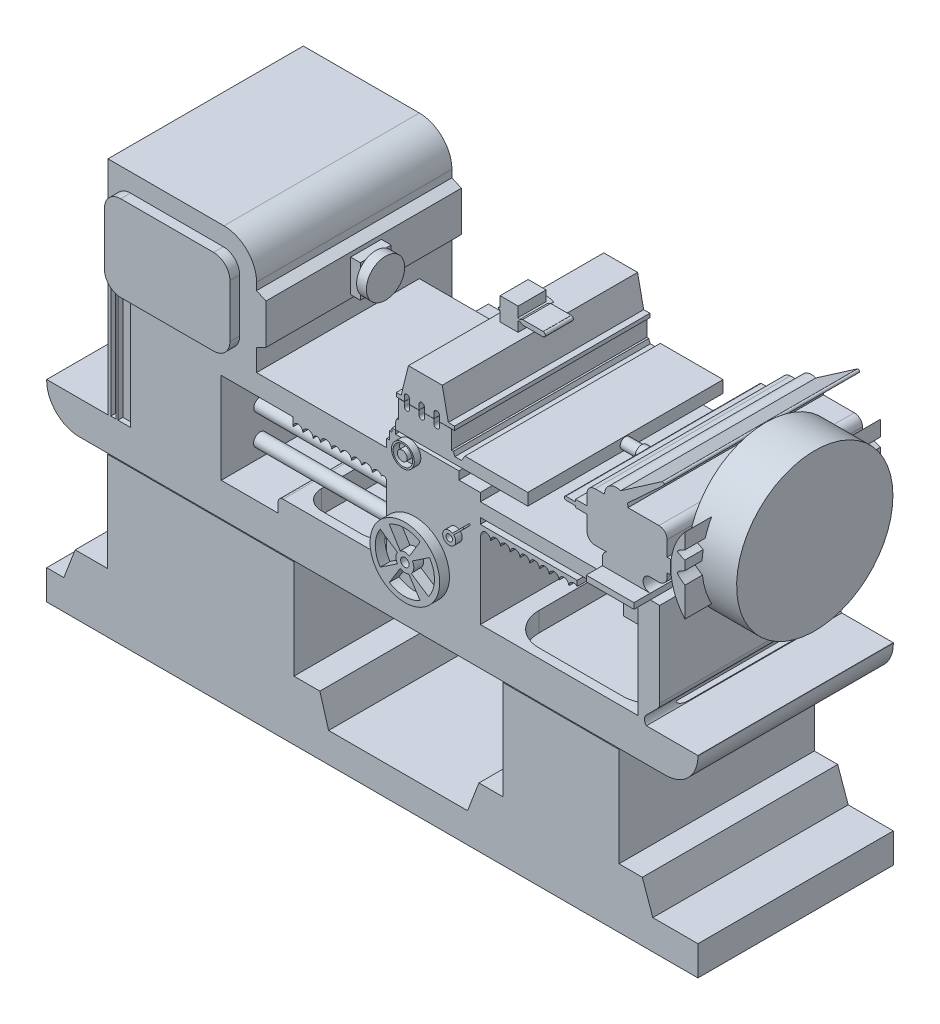
from build123d import *

# Parameters (mm, degrees)
BOSS_EXTRUDE5_DEPTH  = 60
SKETCH5_W            = 57.234946247
SKETCH5_H            = 30.414705735
SKETCH5_W_2          = 35.668154908
BOSS_EXTRUDE6_DEPTH  = 60
BOSS_EXTRUDE7_DEPTH  = 60
BOSS_EXTRUDE8_DEPTH  = 60
SKETCH8_W            = 45.623309293
SKETCH8_H            = 33.775767045
CUT_EXTRUDE2_DEPTH   = 50
SKETCH9_W            = 3.613727469
SKETCH9_H            = 33.775767045
BOSS_EXTRUDE9_DEPTH  = 50
SKETCH10_W           = 7.679170871
SKETCH10_H           = 33.775767045
BOSS_EXTRUDE10_DEPTH = 50
SKETCH11_W           = 23.489228547
SKETCH11_H           = 27.903459908
BOSS_EXTRUDE11_DEPTH = 50
SKETCH12_W           = 74.984844976
SKETCH12_H           = 6.149629091
BOSS_EXTRUDE12_DEPTH = 50
SKETCH14_W           = 4.650299087
SKETCH14_H           = 6.583511459
SKETCH14_H_2         = 6.58351146
BOSS_EXTRUDE13_DEPTH = 15
SKETCH15_R           = 1.5
CUT_EXTRUDE3_DEPTH   = 15
SKETCH16_W           = 1.513910095
SKETCH16_H           = 33.920589402
CUT_EXTRUDE5_DEPTH   = 1.5
SKETCH17_W           = 3.784775236
SKETCH17_H           = 33.726552663
CUT_EXTRUDE6_DEPTH   = 1.5
BOSS_EXTRUDE14_DEPTH = 60
SKETCH19_W           = 9.447911135
SKETCH19_H           = 9.972795087
BOSS_EXTRUDE15_DEPTH = 3
SKETCH20_R           = 5.878993698
BOSS_EXTRUDE16_DEPTH = 3
BOSS_EXTRUDE17_DEPTH = 60
BOSS_EXTRUDE18_DEPTH = 60
SKETCH24_R           = 3.5
SKETCH24_R_2         = 3
BOSS_EXTRUDE19_DEPTH = 2
SKETCH25_R           = 1.5
BOSS_EXTRUDE20_DEPTH = 2.2
SKETCH26_R           = 2
SKETCH26_R_2         = 1
BOSS_EXTRUDE21_DEPTH = 2
BOSS_EXTRUDE22_DEPTH = 2
SKETCH28_R           = 0.202033878
BOSS_EXTRUDE23_DEPTH = 2
SKETCH29_R           = 10.7
SKETCH29_R_2         = 1.3
BOSS_EXTRUDE24_DEPTH = 3
BOSS_EXTRUDE25_DEPTH = 60
SKETCH33_R           = 2
BOSS_EXTRUDE26_DEPTH = 46
BOSS_EXTRUDE27_DEPTH = 60
SKETCH35_W           = 48.387031852
SKETCH35_H           = 28.479224462
CUT_EXTRUDE7_DEPTH   = 50
SKETCH36_W           = 13.207215837
SKETCH36_H           = 23.454193641
BOSS_EXTRUDE28_DEPTH = 10
BOSS_EXTRUDE29_DEPTH = 60
SKETCH38_W           = 48.387031852
SKETCH38_H           = 28.479224462
CUT_EXTRUDE8_DEPTH   = 60
CUT_EXTRUDE9_DEPTH   = 6
SKETCH42_W           = 4.650299087
SKETCH42_H           = 6.583511459
SKETCH42_H_2         = 6.58351146
CUT_EXTRUDE10_DEPTH  = 20
SKETCH44_W           = 6.603607919
SKETCH44_H           = 7.51445039
SKETCH44_W_2         = 6.737344211
BOSS_EXTRUDE30_DEPTH = 5
SKETCH45_R           = 1.45
BOSS_EXTRUDE31_DEPTH = 120
SKETCH46_W           = 5.692765447
SKETCH46_H           = 7.059029154
BOSS_EXTRUDE32_DEPTH = 5
SKETCH48_W           = 10
SKETCH48_H           = 23.454193641
BOSS_EXTRUDE33_DEPTH = 7
CUT_EXTRUDE12_DEPTH  = 7
BOSS_EXTRUDE34_DEPTH = 3
BOSS_EXTRUDE35_DEPTH = 60
SKETCH60_W           = 21.322350294
SKETCH60_H           = 2.452770553
BOSS_EXTRUDE44_DEPTH = 60
BOSS_EXTRUDE48_DEPTH = 60
SKETCH65_W           = 0.979032425
SKETCH65_H           = 1.196132254
BOSS_EXTRUDE49_DEPTH = 60
BOSS_EXTRUDE51_DEPTH = 60
SKETCH67_W           = 16.18883209
SKETCH67_H           = 5.64438207
BOSS_EXTRUDE52_DEPTH = 60
SKETCH68_W           = 17.863538858
SKETCH68_H           = 1.178497355
BOSS_EXTRUDE53_DEPTH = 60
BOSS_EXTRUDE54_DEPTH = 60
SKETCH72_W           = 5.529946497
SKETCH72_H           = 8.612887644
BOSS_EXTRUDE55_DEPTH = 7
BOSS_EXTRUDE57_DEPTH = 8.6
SKETCH76_RX          = 3.47535241
SKETCH76_RY          = 0.637314481
BOSS_EXTRUDE59_DEPTH = 10
CUT_EXTRUDE13_DEPTH  = 60
SKETCH78_R           = 1.633160281
SKETCH78_R_2         = 1.273667461
BOSS_EXTRUDE60_DEPTH = 5
SKETCH79_R           = 2.033084625
BOSS_EXTRUDE61_DEPTH = 2
SKETCH80_R           = 0.5
BOSS_EXTRUDE62_DEPTH = 5
SKETCH81_R           = 1.42642562
CUT_EXTRUDE14_DEPTH  = 1
BOSS_EXTRUDE63_DEPTH = 60
SKETCH85_W           = 14.654686913
SKETCH85_H           = 1.77712501
BOSS_EXTRUDE64_DEPTH = 5
BOSS_EXTRUDE65_DEPTH = 60
SKETCH87_R           = 24
BOSS_EXTRUDE66_DEPTH = 15


with BuildPart() as part:
    # Sketch1 → Boss-Extrude5 (new body)
    with BuildSketch(Plane.XY):
        Polygon((29.251790516, 25.296896181), (-13.41825253, 25.296896181), (-16.101903036, 34.421307902), (-91.244117206, 34.421307902), (-94.732862864, 25.296896181), (-100, 25.296896181), (-100, 16.172484461), (100, 16.172484461), (100, 25.296896181), (86.145181245, 25.296896181), (82.924800638, 34.421307902), (32.740536174, 34.421307902), align=None)
    extrude(amount=-BOSS_EXTRUDE5_DEPTH)

    # Sketch5 → Boss-Extrude6 (add)
    with BuildSketch(Plane.XY):
        with Locations((-52.672740387, 49.62866077)):
            Rectangle(SKETCH5_W, SKETCH5_H)
        with Locations((57.92618956, 49.62866077)):
            Rectangle(SKETCH5_W_2, SKETCH5_H)
    extrude(amount=-BOSS_EXTRUDE6_DEPTH)


with BuildPart() as body_2:
    # Sketch6 → Boss-Extrude7 (new body)
    with BuildSketch(Plane.XY):
        with BuildLine():
            Line((-90, 65.112510962), (90, 65.112510962))
            ThreePointArc((90, 65.112510962), (97.071067812, 68.04144315), (100, 75.112510962))
            Line((100, 75.112510962), (100, 75.342911982))
            Line((100, 75.342911982), (-100, 75.342911982))
            Line((-100, 75.342911982), (-100, 75.112510962))
            ThreePointArc((-100, 75.112510962), (-97.071067812, 68.04144315), (-90, 65.112510962))
        make_face()
    extrude(amount=-BOSS_EXTRUDE7_DEPTH)

    # Sketch7 → Boss-Extrude8 (add)
    with BuildSketch(Plane.XY):
        with BuildLine():
            Line((-81.176697789, 75.342911982), (-35.553388496, 75.342911982))
            Line((-35.553388496, 75.342911982), (-35.553388496, 133.449089979))
            ThreePointArc((-35.553388496, 133.449089979), (-38.482320684, 140.520157791), (-45.553388496, 143.449089979))
            Line((-45.553388496, 143.449089979), (-81.176697789, 143.449089979))
            Line((-81.176697789, 143.449089979), (-81.176697789, 75.342911982))
        make_face()
    extrude(amount=-BOSS_EXTRUDE8_DEPTH)

    # Sketch8 → Cut-Extrude2 (cut)
    with BuildSketch(Plane.XY):
        with Locations((-58.365043142, 92.230795505)):
            Rectangle(SKETCH8_W, SKETCH8_H)
    extrude(amount=-CUT_EXTRUDE2_DEPTH, mode=Mode.SUBTRACT)

    # Sketch9 → Boss-Extrude9 (add)
    with BuildSketch(Plane.XY.offset(-50)):
        with Locations((-79.369834055, 92.230795505)):
            Rectangle(SKETCH9_W, SKETCH9_H)
    extrude(amount=BOSS_EXTRUDE9_DEPTH)

    # Sketch10 → Boss-Extrude10 (add)
    with BuildSketch(Plane.XY.offset(-50)):
        with Locations((-73.723384885, 92.230795505)):
            Rectangle(SKETCH10_W, SKETCH10_H)
    extrude(amount=BOSS_EXTRUDE10_DEPTH)

    # Sketch11 → Boss-Extrude11 (add)
    with BuildSketch(Plane.XY.offset(-50)):
        with Locations((-58.139185176, 89.294641936)):
            Rectangle(SKETCH11_W, SKETCH11_H)
    extrude(amount=BOSS_EXTRUDE11_DEPTH)

    # Sketch12 → Boss-Extrude12 (add)
    with BuildSketch(Plane.XY.offset(-50)):
        with Locations((-32.391376961, 106.321186436)):
            Rectangle(SKETCH12_W, SKETCH12_H)
    extrude(amount=BOSS_EXTRUDE12_DEPTH)

    # Sketch14 → Boss-Extrude13 (add)
    with BuildSketch(Plane.XY):
        with Locations((-44.069421359, 84.799707447)):
            Rectangle(SKETCH14_W, SKETCH14_H)
        with Locations((-44.069421359, 94.230142781)):
            Rectangle(SKETCH14_W, SKETCH14_H_2)
    extrude(amount=-BOSS_EXTRUDE13_DEPTH)

    # Sketch15 → Cut-Extrude3 (cut)
    with BuildSketch(Plane.XY):
        with Locations((-44.057397463, 93.963243668)):
            Circle(SKETCH15_R)
        with Locations((-44.057397463, 84.710741076)):
            Circle(SKETCH15_R)
    extrude(amount=-CUT_EXTRUDE3_DEPTH, mode=Mode.SUBTRACT)

    # Sketch16 → Cut-Extrude5 (cut)
    with BuildSketch(Plane.XY):
        with Locations((-79.539299208, 92.43570628)):
            Rectangle(SKETCH16_W, SKETCH16_H)
    extrude(amount=-CUT_EXTRUDE5_DEPTH, mode=Mode.SUBTRACT)

    # Sketch17 → Cut-Extrude6 (cut)
    with BuildSketch(Plane.XY):
        with Locations((-76.217107611, 92.33868791)):
            Rectangle(SKETCH17_W, SKETCH17_H)
    extrude(amount=-CUT_EXTRUDE6_DEPTH, mode=Mode.SUBTRACT)

    # Sketch18 → Boss-Extrude14 (add)
    with BuildSketch(Plane.XY):
        Polygon((-35.553388496, 131.202790094), (-32.651961784, 129.890580214), (-32.651961784, 117.555807343), (-35.553388496, 116.112376475), align=None)
    extrude(amount=-BOSS_EXTRUDE14_DEPTH)

    # Sketch19 → Boss-Extrude15 (add)
    with BuildSketch(Plane(origin=(-32.651961784, 0, 0), x_dir=(0, 0, -1), z_dir=(1, 0, 0))):
        with Locations((30.705711191, 123.59197279)):
            Rectangle(SKETCH19_W, SKETCH19_H)
    extrude(amount=BOSS_EXTRUDE15_DEPTH)

    # Sketch20 → Boss-Extrude16 (add)
    with BuildSketch(Plane(origin=(-29.651961784, 0, 0), x_dir=(0, 0, -1), z_dir=(1, 0, 0))):
        with Locations((30.70571119, 123.591972791)):
            Circle(SKETCH20_R)
    extrude(amount=BOSS_EXTRUDE16_DEPTH)

    # Sketch22 → Boss-Extrude17 (add)
    with BuildSketch(Plane.XY):
        with BuildLine():
            Line((-28.91924847, 75.342911982), (41.215621835, 75.342911982))
            Line((41.215621835, 75.342911982), (41.215621835, 78.31078722))
            ThreePointArc((41.215621835, 78.31078722), (40.776282007, 79.371447392), (39.715621835, 79.81078722))
            Line((39.715621835, 79.81078722), (-27.41924847, 79.81078722))
            ThreePointArc((-27.41924847, 79.81078722), (-28.479908642, 79.371447392), (-28.91924847, 78.31078722))
            Line((-28.91924847, 78.31078722), (-28.91924847, 75.342911982))
        make_face()
    extrude(amount=-BOSS_EXTRUDE17_DEPTH)

    # Sketch23 → Boss-Extrude18 (add)
    with BuildSketch(Plane.XY):
        with BuildLine():
            Line((4.423957198, 111.884476905), (33.179678984, 111.884476905))
            Line((33.179678984, 111.884476905), (33.179678984, 82.31078722))
            ThreePointArc((33.179678984, 82.31078722), (32.447445937, 80.543020267), (30.679678984, 79.81078722))
            Line((30.679678984, 79.81078722), (4.423957198, 79.81078722))
            Line((4.423957198, 79.81078722), (4.423957198, 111.884476905))
        make_face()
    extrude(amount=-BOSS_EXTRUDE18_DEPTH)

    # Sketch24 → Boss-Extrude19 (add)
    with BuildSketch(Plane.XY):
        with Locations((11.391031665, 111.884476905)):
            Circle(SKETCH24_R)
        with Locations((11.391031665, 111.884476905)):
            Circle(SKETCH24_R_2, mode=Mode.SUBTRACT)
    extrude(amount=BOSS_EXTRUDE19_DEPTH)

    # Sketch25 → Boss-Extrude20 (add)
    with BuildSketch(Plane.XY):
        with Locations((11.391031665, 111.884476905)):
            Circle(SKETCH25_R)
    extrude(amount=BOSS_EXTRUDE20_DEPTH)

    # Sketch26 → Boss-Extrude21 (add)
    with BuildSketch(Plane.XY):
        with Locations((25.612055942, 97.065081106)):
            Circle(SKETCH26_R)
        with Locations((25.612055942, 97.065081106)):
            Circle(SKETCH26_R_2, mode=Mode.SUBTRACT)
    extrude(amount=BOSS_EXTRUDE21_DEPTH)

    # Sketch27 → Boss-Extrude22 (add)
    with BuildSketch(Plane.XY.offset(2)):
        Polygon((26.635662727, 98.783286318), (29.692826514, 101.840450105), (30.008681069, 101.52459555), (27.016191472, 98.489301388), align=None)
    extrude(amount=-BOSS_EXTRUDE22_DEPTH)

    # Sketch28 → Boss-Extrude23 (add)
    with BuildSketch(Plane.XY.offset(2)):
        with Locations((29.850753791, 101.682522828)):
            Circle(SKETCH28_R)
    extrude(amount=-BOSS_EXTRUDE23_DEPTH)

    # Sketch29 → Boss-Extrude24 (add)
    with BuildSketch(Plane.XY):
        with Locations((12.995374269, 84.710741076)):
            Circle(SKETCH29_R)
        with BuildLine():
            ThreePointArc((14.40818223, 87.070078624), (12.975470857, 87.460669049), (11.548563313, 87.049381292))
            Line((11.548563313, 87.049381292), (8.207745287, 92.449514153))
            ThreePointArc((8.207745287, 92.449514153), (12.929512069, 93.810502731), (17.670484249, 92.518003508))
            Line((17.670484249, 92.518003508), (14.40818223, 87.070078624))
        make_face(mode=Mode.SUBTRACT)
        with BuildLine():
            Line((15.282786696, 86.237254878), (20.564629937, 89.762114021))
            ThreePointArc((20.564629937, 89.762114021), (22.091729071, 84.453196289), (20.26669467, 79.239187401))
            Line((20.26669467, 79.239187401), (14.929535988, 82.755870634))
            ThreePointArc((14.929535988, 82.755870634), (15.731325864, 84.433128273), (15.282786696, 86.237254878))
        make_face(mode=Mode.SUBTRACT)
        with BuildLine():
            ThreePointArc((11.548563313, 82.372100861), (12.863143062, 81.963922024), (14.210852386, 82.243938906))
            Line((14.210852386, 82.243938906), (17.670484249, 76.903478645))
            ThreePointArc((17.670484249, 76.903478645), (12.929512069, 75.610979422), (8.207745287, 76.971967999))
            Line((8.207745287, 76.971967999), (11.548563313, 82.372100861))
        make_face(mode=Mode.SUBTRACT)
        with BuildLine():
            ThreePointArc((10.707961841, 86.237254878), (10.245374269, 84.710741076), (10.707961841, 83.184227274))
            Line((10.707961841, 83.184227274), (5.4261186, 79.659368132))
            ThreePointArc((5.4261186, 79.659368132), (3.895374269, 84.710741076), (5.4261186, 89.762114021))
            Line((5.4261186, 89.762114021), (10.707961841, 86.237254878))
        make_face(mode=Mode.SUBTRACT)
        with Locations((12.995374269, 84.710741076)):
            Circle(SKETCH29_R_2, mode=Mode.SUBTRACT)
    extrude(amount=BOSS_EXTRUDE24_DEPTH)

    # Sketch30 → Boss-Extrude25 (add)
    with BuildSketch(Plane.XY):
        with BuildLine():
            Line((33.179678984, 109.396000981), (88.264970058, 109.396000981))
            Line((88.264970058, 109.396000981), (88.264970058, 83.346321126))
            ThreePointArc((88.264970058, 83.346321126), (88.074668889, 82.389612545), (87.532737011, 81.578554173))
            Line((87.532737011, 81.578554173), (84.172538819, 78.218355981))
            ThreePointArc((84.172538819, 78.218355981), (83.577014868, 76.780633982), (84.172538819, 75.342911982))
            Line((84.172538819, 75.342911982), (41.215621835, 75.342911982))
            Line((41.215621835, 75.342911982), (41.215621835, 78.31078722))
            ThreePointArc((41.215621835, 78.31078722), (40.776282007, 79.371447392), (39.715621835, 79.81078722))
            Line((39.715621835, 79.81078722), (30.679678984, 79.81078722))
            ThreePointArc((30.679678984, 79.81078722), (32.447445937, 80.543020267), (33.179678984, 82.31078722))
            Line((33.179678984, 82.31078722), (33.179678984, 109.396000981))
        make_face()
    extrude(amount=-BOSS_EXTRUDE25_DEPTH)

    # Sketch33 → Boss-Extrude26 (add)
    with BuildSketch(Plane(origin=(-41.744271815, 0, 0), x_dir=(0, 0, -1), z_dir=(1, 0, 0))):
        with Locations((7.354473749, 94.180815751)):
            Circle(SKETCH33_R)
        with Locations((7.282863787, 84.879708341)):
            Circle(SKETCH33_R)
    extrude(amount=BOSS_EXTRUDE26_DEPTH)

    # Sketch34 → Boss-Extrude27 (add)
    with BuildSketch(Plane.XY):
        with BuildLine():
            Line((-24.345237224, 103.24637189), (4.423957198, 103.24637189))
            Line((4.423957198, 103.24637189), (4.423957198, 100.58350564))
            ThreePointArc((4.423957198, 100.58350564), (3.793878282, 101.426547958), (2.806905985, 101.061027131))
            ThreePointArc((2.806905985, 101.061027131), (1.201880656, 102.007123214), (0, 100.58350564))
            ThreePointArc((0, 100.58350564), (-1.477042085, 102.219011576), (-3.254099046, 100.915707489))
            ThreePointArc((-3.254099046, 100.915707489), (-4.960353514, 102.149272205), (-6.367961869, 100.58350564))
            ThreePointArc((-6.367961869, 100.58350564), (-7.847791894, 102.274335851), (-9.719802323, 101.03160472))
            ThreePointArc((-9.719802323, 101.03160472), (-11.318786739, 102.008996078), (-12.535348304, 100.58350564))
            ThreePointArc((-12.535348304, 100.58350564), (-14.241221148, 102.289378484), (-15.947093992, 100.58350564))
            ThreePointArc((-15.947093992, 100.58350564), (-17.06247239, 101.698884038), (-18.177850788, 100.58350564))
            ThreePointArc((-18.177850788, 100.58350564), (-19.752502644, 102.158157496), (-21.3271545, 100.58350564))
            ThreePointArc((-21.3271545, 100.58350564), (-22.836195862, 102.092547002), (-24.345237224, 100.58350564))
            Line((-24.345237224, 100.58350564), (-24.345237224, 103.24637189))
        make_face()
    extrude(amount=-BOSS_EXTRUDE27_DEPTH)

    # Sketch35 → Cut-Extrude7 (cut)
    with BuildSketch(Plane.XY):
        with Locations((57.37319491, 91.008928877)):
            Rectangle(SKETCH35_W, SKETCH35_H)
    extrude(amount=-CUT_EXTRUDE7_DEPTH, mode=Mode.SUBTRACT)

    # Sketch36 → Boss-Extrude28 (add)
    with BuildSketch(Plane.ZY.offset(-81.566710836)):
        with Locations((-18.480732814, 91.310173423)):
            Rectangle(SKETCH36_W, SKETCH36_H)
    extrude(amount=BOSS_EXTRUDE28_DEPTH)

    # Sketch37 → Boss-Extrude29 (add)
    with BuildSketch(Plane.XY):
        with BuildLine():
            Line((33.179678984, 103.398523885), (62.912111006, 103.398523885))
            Line((62.912111006, 103.398523885), (62.912111006, 101.727825956))
            ThreePointArc((62.912111006, 101.727825956), (61.2816861, 102.057792885), (60.355969785, 100.675688384))
            Line((60.355969785, 100.675688384), (60.345183115, 100.675688384))
            ThreePointArc((60.345183115, 100.675688384), (58.85057645, 102.170295049), (57.355969785, 100.675688384))
            Line((57.355969785, 100.675688384), (57.345183115, 100.675688384))
            ThreePointArc((57.345183115, 100.675688384), (55.85057645, 102.170295049), (54.355969785, 100.675688384))
            Line((54.355969785, 100.675688384), (54.345183115, 100.675688384))
            ThreePointArc((54.345183115, 100.675688384), (52.85057645, 102.170295049), (51.355969785, 100.675688384))
            Line((51.355969785, 100.675688384), (51.345183115, 100.675688384))
            ThreePointArc((51.345183115, 100.675688384), (49.85057645, 102.170295049), (48.355969785, 100.675688384))
            Line((48.355969785, 100.675688384), (48.345183115, 100.675688384))
            ThreePointArc((48.345183115, 100.675688384), (46.85057645, 102.170295049), (45.355969785, 100.675688384))
            Line((45.355969785, 100.675688384), (45.345183115, 100.675688384))
            ThreePointArc((45.345183115, 100.675688384), (43.85057645, 102.170295049), (42.355969785, 100.675688384))
            Line((42.355969785, 100.675688384), (42.345183115, 100.675688384))
            ThreePointArc((42.345183115, 100.675688384), (40.85057645, 102.170295049), (39.355969785, 100.675688384))
            Line((39.355969785, 100.675688384), (39.345183115, 100.675688384))
            ThreePointArc((39.345183115, 100.675688384), (37.85057645, 102.170295049), (36.355969785, 100.675688384))
            Line((36.355969785, 100.675688384), (36.345183115, 100.675688384))
            ThreePointArc((36.345183115, 100.675688384), (34.85057645, 102.170295049), (33.355969785, 100.675688384))
            Line((33.355969785, 100.675688384), (33.179678984, 100.675688384))
            Line((33.179678984, 100.675688384), (33.179678984, 103.398523885))
        make_face()
    extrude(amount=-BOSS_EXTRUDE29_DEPTH)

    # Sketch38 → Cut-Extrude8 (cut)
    with BuildSketch(Plane.XY.offset(-50)):
        with Locations((57.37319491, 91.008928877)):
            Rectangle(SKETCH38_W, SKETCH38_H)
    extrude(amount=-CUT_EXTRUDE8_DEPTH, mode=Mode.SUBTRACT)

    # Sketch39 → Cut-Extrude9 (cut)
    with BuildSketch(Plane(origin=(0, 76.769316646, 0), x_dir=(1, 0, 0), z_dir=(0, 1, 0))):
        with BuildLine():
            Line((48.433128157, 2.785748787), (74.05518676, 2.785748787))
            ThreePointArc((74.05518676, 2.785748787), (81.126254572, 5.714680975), (84.05518676, 12.785748787))
            Line((84.05518676, 12.785748787), (84.05518676, 46.702727137))
            ThreePointArc((84.05518676, 46.702727137), (81.126254572, 53.773794948), (74.05518676, 56.702727137))
            Line((74.05518676, 56.702727137), (48.433128157, 56.702727137))
            ThreePointArc((48.433128157, 56.702727137), (41.362060345, 53.773794948), (38.433128157, 46.702727137))
            Line((38.433128157, 46.702727137), (38.433128157, 12.785748787))
            ThreePointArc((38.433128157, 12.785748787), (41.362060345, 5.714680975), (48.433128157, 2.785748787))
        make_face()
    extrude(amount=-CUT_EXTRUDE9_DEPTH, mode=Mode.SUBTRACT)

    # Sketch42 → Cut-Extrude10 (cut)
    with BuildSketch(Plane.XY):
        with Locations((-44.069421359, 84.799707447)):
            Rectangle(SKETCH42_W, SKETCH42_H)
        with Locations((-44.069421359, 94.230142781)):
            Rectangle(SKETCH42_W, SKETCH42_H_2)
    extrude(amount=-CUT_EXTRUDE10_DEPTH, mode=Mode.SUBTRACT)


with BuildPart() as cut_extrude10_piece_1:
    # of the separate pieces the step leaves, piece 1, a body of its own (cut_extrude10_pieces)
    add(body_2.part.solids().sort_by_distance((-90, 65.112510962, 0))[0])

    # Sketch44 → Boss-Extrude30 (add)
    with BuildSketch(Plane(origin=(-46.394570902, 0, 0), x_dir=(0, 0, -1), z_dir=(1, 0, 0))):
        with Locations((14.723507619, 93.814990219)):
            Rectangle(SKETCH44_W, SKETCH44_H)
        with Locations((26.631327895, 93.814990219)):
            Rectangle(SKETCH44_W_2, SKETCH44_H)
    extrude(amount=BOSS_EXTRUDE30_DEPTH)

    # Sketch45 → Boss-Extrude31 (add)
    with BuildSketch(Plane(origin=(-41.394570902, 0, 0), x_dir=(0, 0, -1), z_dir=(1, 0, 0))):
        with Locations((14.620036159, 93.521615467)):
            Circle(SKETCH45_R)
        with Locations((25.598687099, 93.521615467)):
            Circle(SKETCH45_R)
    extrude(amount=BOSS_EXTRUDE31_DEPTH)

    # Sketch46 → Boss-Extrude32 (add)
    with BuildSketch(Plane.ZY.offset(-71.566710836)):
        with Locations((-13.357243912, 94.042700837)):
            Rectangle(SKETCH46_W, SKETCH46_H)
        with Locations((-27.47530222, 94.042700837)):
            Rectangle(SKETCH46_W, SKETCH46_H)
    extrude(amount=BOSS_EXTRUDE32_DEPTH)

    # Sketch48 → Boss-Extrude33 (add)
    with BuildSketch(Plane(origin=(0, 0, -25.084340732), x_dir=(-1, 0, 0), z_dir=(0, 0, -1))):
        with Locations((-76.566710836, 91.310173423)):
            Rectangle(SKETCH48_W, SKETCH48_H)
    extrude(amount=BOSS_EXTRUDE33_DEPTH)

    # Sketch49 → Cut-Extrude12 (cut)
    with BuildSketch(Plane(origin=(0, 79.81078722, 0), x_dir=(1, 0, 0), z_dir=(0, 1, 0))):
        with BuildLine():
            Line((-18.345237224, 58.085213761), (-6, 58.085213761))
            ThreePointArc((-6, 58.085213761), (-1.757359313, 56.327854448), (0, 52.085213761))
            Line((0, 52.085213761), (0, 8.785748787))
            ThreePointArc((0, 8.785748787), (-1.757359313, 4.5431081), (-6, 2.785748787))
            Line((-6, 2.785748787), (-18.345237224, 2.785748787))
            ThreePointArc((-18.345237224, 2.785748787), (-22.587877911, 4.5431081), (-24.345237224, 8.785748787))
            Line((-24.345237224, 8.785748787), (-24.345237224, 52.085213761))
            ThreePointArc((-24.345237224, 52.085213761), (-22.587877911, 56.327854448), (-18.345237224, 58.085213761))
        make_face()
    extrude(amount=-CUT_EXTRUDE12_DEPTH, mode=Mode.SUBTRACT)

    # Sketch50 → Boss-Extrude34 (add)
    with BuildSketch(Plane.XY):
        with BuildLine():
            Line((-74.263602192, 111.524869112), (-45.742576987, 111.524869112))
            ThreePointArc((-45.742576987, 111.524869112), (-42.207043081, 112.989335206), (-40.742576987, 116.524869112))
            Line((-40.742576987, 116.524869112), (-40.742576987, 132.782683431))
            ThreePointArc((-40.742576987, 132.782683431), (-42.207043081, 136.318217337), (-45.742576987, 137.782683431))
            Line((-45.742576987, 137.782683431), (-74.263602192, 137.782683431))
            ThreePointArc((-74.263602192, 137.782683431), (-77.799136098, 136.318217337), (-79.263602192, 132.782683431))
            Line((-79.263602192, 132.782683431), (-79.263602192, 116.524869112))
            ThreePointArc((-79.263602192, 116.524869112), (-77.799136098, 112.989335206), (-74.263602192, 111.524869112))
        make_face()
    extrude(amount=BOSS_EXTRUDE34_DEPTH)

    # Sketch51 → Boss-Extrude35 (add)
    with BuildSketch(Plane(origin=(0, 0, -60), x_dir=(-1, 0, 0), z_dir=(0, 0, -1))):
        with BuildLine():
            Line((-25.437753888, 111.884476905), (-6.082941147, 111.884476905))
            Line((-6.082941147, 111.884476905), (-6.082941147, 112.543460854))
            ThreePointArc((-6.082941147, 112.543460854), (-6.375834366, 113.250567635), (-7.082941147, 113.543460854))
            Line((-7.082941147, 113.543460854), (-24.437753888, 113.543460854))
            ThreePointArc((-24.437753888, 113.543460854), (-25.144860669, 113.250567635), (-25.437753888, 112.543460854))
            Line((-25.437753888, 112.543460854), (-25.437753888, 111.884476905))
        make_face()
    extrude(amount=-BOSS_EXTRUDE35_DEPTH)

    # Sketch60 → Boss-Extrude44 (add)
    with BuildSketch(Plane.XY):
        with Locations((15.914624319, 113.110862182)):
            Rectangle(SKETCH60_W, SKETCH60_H)
    extrude(amount=-BOSS_EXTRUDE44_DEPTH)

    # Sketch65 → Boss-Extrude49 (add)
    with BuildSketch(Plane.XY):
        with Locations((6.584333581, 114.935313585)):
            Rectangle(SKETCH65_W, SKETCH65_H)
    extrude(amount=-BOSS_EXTRUDE49_DEPTH)

    # Sketch84 → Boss-Extrude63 (add)
    with BuildSketch(Plane.XY):
        with BuildLine():
            Line((70.702436864, 109.396000981), (85.357123777, 109.396000981))
            Line((85.357123777, 109.396000981), (85.357123777, 111.173125991))
            ThreePointArc((85.357123777, 111.173125991), (83.169859119, 113.360390649), (85.357123777, 115.547655307))
            Line((85.357123777, 115.547655307), (72.702436864, 115.547655307))
            ThreePointArc((72.702436864, 115.547655307), (71.288223301, 114.96186887), (70.702436864, 113.547655307))
            Line((70.702436864, 113.547655307), (70.702436864, 109.396000981))
        make_face()
    extrude(amount=-BOSS_EXTRUDE63_DEPTH)

    # Sketch85 → Boss-Extrude64 (add)
    with BuildSketch(Plane.XY):
        with Locations((78.029780321, 110.284563486)):
            Rectangle(SKETCH85_W, SKETCH85_H)
    extrude(amount=BOSS_EXTRUDE64_DEPTH)

    # Sketch86 → Boss-Extrude65 (add)
    with BuildSketch(Plane.XY):
        with BuildLine():
            Line((88.897389815, 142.614684305), (76.225831181, 133.869012591))
            ThreePointArc((76.225831181, 133.869012591), (72.884104722, 133.487902473), (71.313842658, 130.513569321))
            Line((71.313842658, 130.513569321), (68.430778858, 130.513569321))
            ThreePointArc((68.430778858, 130.513569321), (66.663011905, 129.781336274), (65.930778858, 128.013569321))
            Line((65.930778858, 128.013569321), (65.930778858, 124.704478769))
            Line((65.930778858, 124.704478769), (62.404080278, 124.704478769))
            Line((62.404080278, 124.704478769), (62.404080278, 124.017988218))
            Line((62.404080278, 124.017988218), (59.467609642, 124.017988218))
            Line((59.467609642, 124.017988218), (59.467609642, 124.007486131))
            ThreePointArc((59.467609642, 124.007486131), (58.950042074, 123.489918564), (59.467609642, 122.972350996))
            Line((59.467609642, 122.972350996), (59.467609642, 122.961848909))
            Line((59.467609642, 122.961848909), (62.404080278, 122.961848909))
            Line((62.404080278, 122.961848909), (62.404080278, 122.479466812))
            Line((62.404080278, 122.479466812), (65.930778858, 122.479466812))
            Line((65.930778858, 122.479466812), (65.930778858, 117.959997032))
            ThreePointArc((65.930778858, 117.959997032), (66.663011905, 116.19223008), (68.430778858, 115.459997032))
            Line((68.430778858, 115.459997032), (72.116818279, 115.459997032))
            ThreePointArc((72.116818279, 115.459997032), (72.406365462, 115.525619343), (72.702436864, 115.547655307))
            Line((72.702436864, 115.547655307), (85.357123777, 115.547655307))
            ThreePointArc((85.357123777, 115.547655307), (85.04750155, 115.525629842), (84.744115033, 115.459997032))
            Line((84.744115033, 115.459997032), (88.024870598, 115.459997032))
            ThreePointArc((88.024870598, 115.459997032), (89.792637551, 116.19223008), (90.524870598, 117.959997032))
            Line((90.524870598, 117.959997032), (90.524870598, 119.172393547))
            Line((90.524870598, 119.172393547), (91.647234317, 119.172393547))
            Line((91.647234317, 119.172393547), (91.647234317, 121.26503962))
            Line((91.647234317, 121.26503962), (91.647234317, 123.357685693))
            Line((91.647234317, 123.357685693), (90.524870598, 123.357685693))
            Line((90.524870598, 123.357685693), (90.524870598, 128.013569321))
            ThreePointArc((90.524870598, 128.013569321), (89.792637551, 129.781336274), (88.024870598, 130.513569321))
            Line((88.024870598, 130.513569321), (78.517978135, 130.513569321))
            ThreePointArc((78.517978135, 130.513569321), (78.472631872, 131.083327465), (78.337734805, 131.638740291))
            Line((78.337734805, 131.638740291), (89.460320616, 141.911244663))
            ThreePointArc((89.460320615, 141.911244663), (89.506518129, 142.525178233), (88.897389816, 142.614684305))
        make_face()
        with BuildLine():
            ThreePointArc((95.999621524, 132.751991078), (92.771809403, 127.406971893), (91.647234317, 121.26503962))
            ThreePointArc((91.647234317, 121.26503962), (92.770859001, 115.046758129), (95.999621524, 109.61493986))
            Line((95.999621524, 109.61493986), (95.999621524, 118.64394795))
            add(Edge.make_bspline(
                [(95.999621524, 122.497693094), (92.954467545, 120.881606421), (95.999621524, 118.64394795)],
                knots=[0, 0, 0, 1, 1, 1], degree=2, weights=[1, 3, 1]))
            Line((95.999621524, 122.497693094), (95.999621524, 125.321911691))
            add(Edge.make_bspline(
                [(95.999621524, 128.013569321), (92.908103737, 126.491990009), (95.999621524, 125.321911691)],
                knots=[0, 0, 0, 1, 1, 1], degree=2, weights=[1, 2.7, 1]))
            Line((95.999621524, 128.013569321), (95.999621524, 132.751991078))
        make_face()
    extrude(amount=-BOSS_EXTRUDE65_DEPTH)


with BuildPart() as cut_extrude10_piece_2:
    # of the separate pieces the step leaves, piece 2, a body of its own (cut_extrude10_pieces)
    add(body_2.part.solids().sort_by_distance((-41.744271815, 94.180815751, -9.354473749))[0])


with BuildPart() as cut_extrude10_piece_3:
    # of the separate pieces the step leaves, piece 3, a body of its own (cut_extrude10_pieces)
    add(body_2.part.solids().sort_by_distance((-41.744271815, 84.879708341, -9.282863787))[0])


with BuildPart() as body_5:
    # Sketch61 → Boss-Extrude48 (new body)
    with BuildSketch(Plane.XY):
        Polygon((7.073849793, 117.518217363), (7.073849793, 115.533379712), (47.747728278, 115.533379712), (47.747728278, 119.192924131), (28.457587358, 119.192924131), (27.410789036, 117.518217363), align=None)
    extrude(amount=-BOSS_EXTRUDE48_DEPTH)

    # Sketch66 → Boss-Extrude51 (add)
    with BuildSketch(Plane.XY):
        Polygon((24.867569205, 118.696714718), (25.384958287, 117.518217363), (7.073849793, 117.518217363), (7.539954654, 118.696714718), align=None)
    extrude(amount=-BOSS_EXTRUDE51_DEPTH)

    # Sketch67 → Boss-Extrude52 (add)
    with BuildSketch(Plane.XY):
        with Locations((16.194639879, 121.518905753)):
            Rectangle(SKETCH67_W, SKETCH67_H)
    extrude(amount=-BOSS_EXTRUDE52_DEPTH)


with BuildPart() as body_6:
    # Sketch68 → Boss-Extrude53 (new body)
    with BuildSketch(Plane.XY):
        with Locations((16.313379926, 124.992371642)):
            Rectangle(SKETCH68_W, SKETCH68_H)
    extrude(amount=-BOSS_EXTRUDE53_DEPTH)

    # Sketch69 → Boss-Extrude54 (add)
    with BuildSketch(Plane.XY):
        Polygon((8.86181747, 125.581620319), (23.334592008, 125.581620319), (21.47380671, 134.563828647), (11.084422131, 134.563828647), align=None)
    extrude(amount=-BOSS_EXTRUDE54_DEPTH)

    # Sketch72 → Boss-Extrude55 (add)
    with BuildSketch(Plane(origin=(0, 134.563828647, 0), x_dir=(1, 0, 0), z_dir=(0, 1, 0))):
        with Locations((16.313342168, 30)):
            Rectangle(SKETCH72_W, SKETCH72_H)
    extrude(amount=BOSS_EXTRUDE55_DEPTH)



with BuildPart() as body_7:
    # Sketch74 → Boss-Extrude57 (new body)
    with BuildSketch(Plane.XY.offset(-25.693556178)):
        with BuildLine():
            Line((19.078315416, 138.063828647), (20.456250673, 138.663110608))
            Line((20.456250673, 138.663110608), (26.780620186, 138.663110608))
            Line((26.780620186, 138.663110608), (26.780620186, 138.610113098))
            ThreePointArc((26.780620186, 138.610113098), (27.451921978, 137.938811306), (26.780620186, 137.267509514))
            Line((26.780620186, 137.267509514), (26.780620186, 137.214512004))
            Line((26.780620186, 137.214512004), (20.456250673, 137.214512004))
            Line((20.456250673, 137.214512004), (19.078315416, 138.063828647))
        make_face()
    extrude(amount=-BOSS_EXTRUDE57_DEPTH)


with BuildPart() as body_6_1:
    add(body_6.part)

    add(body_7.part)  # Boss-Extrude59 merges body 7
    # Sketch76 → Boss-Extrude59 (add)
    with BuildSketch(Plane.XY.offset(-25.693556178)):
        with Locations((16.427543309, 138.042700705)):
            Ellipse(SKETCH76_RX, SKETCH76_RY)
    extrude(amount=-BOSS_EXTRUDE59_DEPTH)


with BuildPart() as cut_extrude13_tool:
    # Sketch77 → Cut-Extrude13 (new body)
    with BuildSketch(Plane.XY):
        with BuildLine():
            Line((11.393684256, 125.986529117), (11.393684256, 123.043152749))
            ThreePointArc((11.393684256, 123.043152749), (10.612788485, 122.262256977), (9.831892714, 123.043152749))
            Line((9.831892714, 123.043152749), (9.831892714, 125.986529117))
            ThreePointArc((9.831892714, 125.986529117), (10.612788485, 126.767424888), (11.393684256, 125.986529117))
        make_face()
        with BuildLine():
            Line((16.018989978, 125.986529117), (16.018989978, 123.043152749))
            ThreePointArc((16.018989978, 123.043152749), (15.178025301, 122.202188072), (14.337060624, 123.043152749))
            Line((14.337060624, 123.043152749), (14.337060624, 125.986529117))
            ThreePointArc((14.337060624, 125.986529117), (15.178025301, 126.827493793), (16.018989978, 125.986529117))
        make_face()
        with BuildLine():
            Line((20.704364604, 125.986529117), (20.704364604, 123.043152749))
            ThreePointArc((20.704364604, 123.043152749), (19.803331022, 122.142119167), (18.90229744, 123.043152749))
            Line((18.90229744, 123.043152749), (18.90229744, 125.986529117))
            ThreePointArc((18.90229744, 125.986529117), (19.803331022, 126.887562699), (20.704364604, 125.986529117))
        make_face()
    extrude(amount=-CUT_EXTRUDE13_DEPTH)


with BuildPart() as body_5_1:
    add(body_5.part)

    # Cut-Extrude13: cut by cut_extrude13_tool
    add(cut_extrude13_tool.part, mode=Mode.SUBTRACT)

    # Sketch78 → Boss-Extrude60 (add)
    with BuildSketch(Plane(origin=(47.747728278, 0, 0), x_dir=(0, 0, -1), z_dir=(1, 0, 0))):
        with Locations((30, 117.362772194)):
            Circle(SKETCH78_R)
        with Locations((30, 117.362772194)):
            Circle(SKETCH78_R_2, mode=Mode.SUBTRACT)
    extrude(amount=BOSS_EXTRUDE60_DEPTH)

    # Sketch79 → Boss-Extrude61 (add)
    with BuildSketch(Plane(origin=(52.747728278, 0, 0), x_dir=(0, 0, -1), z_dir=(1, 0, 0))):
        with Locations((30, 117.362772194)):
            Circle(SKETCH79_R)
    extrude(amount=BOSS_EXTRUDE61_DEPTH)

    # Sketch80 → Boss-Extrude62 (add)
    with BuildSketch(Plane(origin=(54.747728278, 0, 0), x_dir=(0, 0, -1), z_dir=(1, 0, 0))):
        with Locations((30, 118.750492308)):
            Circle(SKETCH80_R)
    extrude(amount=BOSS_EXTRUDE62_DEPTH)

    # Sketch81 → Cut-Extrude14 (cut)
    with BuildSketch(Plane(origin=(54.747728278, 0, 0), x_dir=(0, 0, -1), z_dir=(1, 0, 0))):
        with Locations((30, 117.362772194)):
            Circle(SKETCH81_R)
    extrude(amount=-CUT_EXTRUDE14_DEPTH, mode=Mode.SUBTRACT)


with BuildPart() as body_6_2:
    add(body_6_1.part)

    # Cut-Extrude13: cut by cut_extrude13_tool
    add(cut_extrude13_tool.part, mode=Mode.SUBTRACT)


with BuildPart() as boss_extrude65_piece_1:
    # of the separate pieces the step leaves, piece 1, a body of its own (boss_extrude65_pieces)
    add(cut_extrude10_piece_1.part.solids().sort_by_distance((-90, 65.112510962, 0))[0])

    # Sketch87 → Boss-Extrude66 (add)
    with BuildSketch(Plane(origin=(91.647234317, 0, 0), x_dir=(0, 0, -1), z_dir=(1, 0, 0))):
        with Locations((29.231267161, 121.173256182)):
            Circle(SKETCH87_R)
    extrude(amount=BOSS_EXTRUDE66_DEPTH)


with BuildPart() as boss_extrude65_piece_2:
    # of the separate pieces the step leaves, piece 2, a body of its own (boss_extrude65_pieces)
    add(cut_extrude10_piece_1.part.solids().sort_by_distance((95.999621524, 132.751991078, 0))[0])


solid = Compound([part.part, cut_extrude10_piece_2.part, cut_extrude10_piece_3.part, body_5_1.part, body_6_2.part, boss_extrude65_piece_1.part, boss_extrude65_piece_2.part])
